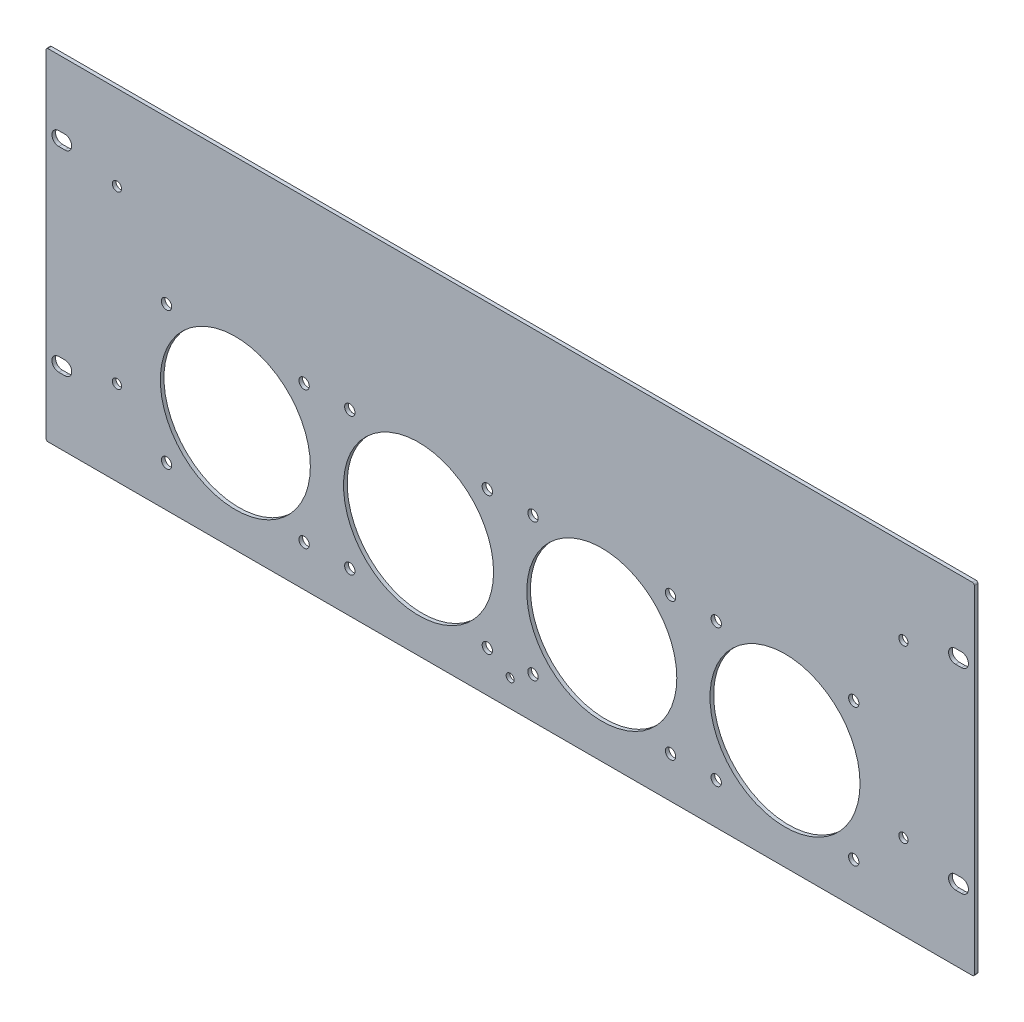
from build123d import *

# Parameters (mm, degrees)
FRONT_PANEL_DEPTH        = 1.905
RACK_MOUNTING_SLOT_DEPTH = 1.905
SKETCH3_R                = 2.387599998
SKETCH3_R_2              = 2.0701
SKETCH3_R_3              = 2.387600002
CUT_EXTRUDE1_DEPTH       = 1.905
SKETCH4_R                = 2.6924
SKETCH4_R_2              = 39.0017
CUT_EXTRUDE4_DEPTH       = 1.905


# Sheet-metal steps are written as plain solids
with BuildPart() as part:
    # Sketch1 → Front Panel (new body)
    with BuildSketch(Plane.XY):
        with BuildLine():
            Line((-240.284, 0), (240.284, 0))
            ThreePointArc((240.284, 0), (241.00242049, 0.29757951), (241.3, 1.016))
            Line((241.3, 1.016), (241.3, 176.022))
            ThreePointArc((241.3, 176.022), (241.00242049, 176.74042049), (240.284, 177.038))
            Line((240.284, 177.038), (-240.284, 177.038))
            ThreePointArc((-240.284, 177.038), (-241.00242049, 176.74042049), (-241.3, 176.022))
            Line((-241.3, 176.022), (-241.3, 1.016))
            ThreePointArc((-241.3, 1.016), (-241.00242049, 0.29757951), (-240.284, 0))
        make_face()
    extrude(amount=FRONT_PANEL_DEPTH)

    # Sketch2 → Rack Mounting Slot (cut)
    with BuildSketch(Plane.XY.offset(1.905)):
        with BuildLine():
            Line((231.4702, 135.7884), (234.6706, 135.7884))
            ThreePointArc((234.6706, 135.7884), (238.2266, 139.3444), (234.6706, 142.9004))
            Line((234.6706, 142.9004), (231.4702, 142.9004))
            ThreePointArc((231.4702, 142.9004), (227.9142, 139.3444), (231.4702, 135.7884))
        make_face()
        with BuildLine():
            Line((-231.4702, 41.2496), (-234.6706, 41.2496))
            ThreePointArc((-234.6706, 41.2496), (-238.2266, 37.6936), (-234.6706, 34.1376))
            Line((-234.6706, 34.1376), (-231.4702, 34.1376))
            ThreePointArc((-231.4702, 34.1376), (-227.9142, 37.6936), (-231.4702, 41.2496))
        make_face()
        with BuildLine():
            Line((-234.6706, 142.9004), (-231.4702, 142.9004))
            ThreePointArc((-231.4702, 142.9004), (-227.9142, 139.3444), (-231.4702, 135.7884))
            Line((-231.4702, 135.7884), (-234.6706, 135.7884))
            ThreePointArc((-234.6706, 135.7884), (-238.2266, 139.3444), (-234.6706, 142.9004))
        make_face()
        with BuildLine():
            Line((234.6706, 34.1376), (231.4702, 34.1376))
            ThreePointArc((231.4702, 34.1376), (227.9142, 37.6936), (231.4702, 41.2496))
            Line((231.4702, 41.2496), (234.6706, 41.2496))
            ThreePointArc((234.6706, 41.2496), (238.2266, 37.6936), (234.6706, 34.1376))
        make_face()
    extrude(amount=-RACK_MOUNTING_SLOT_DEPTH, mode=Mode.SUBTRACT)

    # Sketch3 → Cut-Extrude1 (cut)
    with BuildSketch(Plane.XY.offset(1.905)):
        with Locations((-204.4192, 132.969)):
            Circle(SKETCH3_R)
        with Locations((-204.4192, 44.069)):
            Circle(SKETCH3_R)
        with Locations((0, 13.9192)):
            Circle(SKETCH3_R_2)
        with Locations((204.4192, 44.069)):
            Circle(SKETCH3_R_3)
        with Locations((204.4192, 132.969)):
            Circle(SKETCH3_R_3)
    extrude(amount=-CUT_EXTRUDE1_DEPTH, mode=Mode.SUBTRACT)

    # Sketch4 → Cut-Extrude4 (cut)
    with BuildSketch(Plane.XY.offset(1.905)):
        with Locations((-107.125, 92.9)):
            Circle(SKETCH4_R)
        with Locations((-178.625, 92.9)):
            Circle(SKETCH4_R)
        with Locations((-107.125, 21.4)):
            Circle(SKETCH4_R)
        with Locations((-178.625, 21.4)):
            Circle(SKETCH4_R)
        with Locations((-142.875, 57.15)):
            Circle(SKETCH4_R_2)
        with Locations((-11.875, 92.9)):
            Circle(SKETCH4_R)
        with Locations((-83.375, 92.9)):
            Circle(SKETCH4_R)
        with Locations((-11.875, 21.4)):
            Circle(SKETCH4_R)
        with Locations((-83.375, 21.4)):
            Circle(SKETCH4_R)
        with Locations((-47.625, 57.15)):
            Circle(SKETCH4_R_2)
        with Locations((83.375, 92.9)):
            Circle(SKETCH4_R)
        with Locations((11.875, 92.9)):
            Circle(SKETCH4_R)
        with Locations((83.375, 21.4)):
            Circle(SKETCH4_R)
        with Locations((11.875, 21.4)):
            Circle(SKETCH4_R)
        with Locations((47.625, 57.15)):
            Circle(SKETCH4_R_2)
        with Locations((178.625, 92.9)):
            Circle(SKETCH4_R)
        with Locations((107.125, 92.9)):
            Circle(SKETCH4_R)
        with Locations((178.625, 21.4)):
            Circle(SKETCH4_R)
        with Locations((107.125, 21.4)):
            Circle(SKETCH4_R)
        with Locations((142.875, 57.15)):
            Circle(SKETCH4_R_2)
    extrude(amount=-CUT_EXTRUDE4_DEPTH, mode=Mode.SUBTRACT)


solid = part.part
